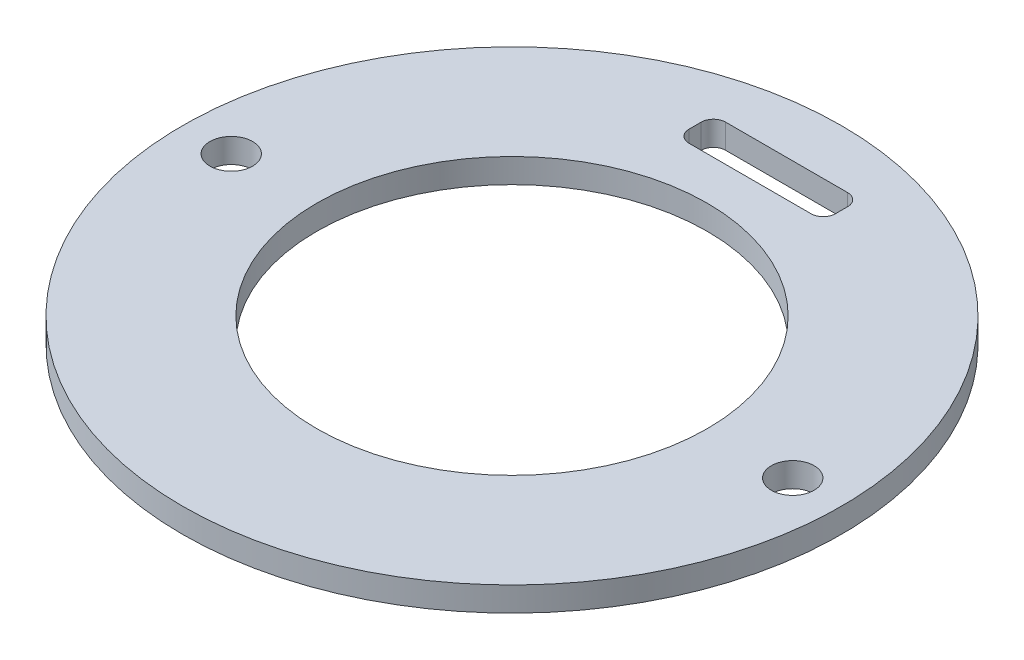
from build123d import *

# Parameters (mm, degrees)
SKETCH1_R           = 27
SKETCH1_R_2         = 16
SKETCH1_R_3         = 1.75
BOSS_EXTRUDE1_DEPTH = 2
SKETCH2_W           = 12
SKETCH2_H           = 3
CUT_EXTRUDE1_DEPTH  = 39.236108589
FILLET1_R           = 1


with BuildPart() as part:
    # Sketch1 → Boss-Extrude1 (new body)
    with BuildSketch(Plane(origin=(0, 0, 0), x_dir=(1, 0, 0), z_dir=(0, 1, 0))):
        Circle(SKETCH1_R)
        Circle(SKETCH1_R_2, mode=Mode.SUBTRACT)
        with Locations((-23, 0)):
            Circle(SKETCH1_R_3, mode=Mode.SUBTRACT)
        with Locations((23, 0)):
            Circle(SKETCH1_R_3, mode=Mode.SUBTRACT)
    extrude(amount=BOSS_EXTRUDE1_DEPTH)

    # Sketch2 → Cut-Extrude1 (cut, through all)
    with BuildSketch(Plane(origin=(0, 2, 0), x_dir=(1, 0, 0), z_dir=(0, 1, 0))):
        with Locations((0, 21)):
            Rectangle(SKETCH2_W, SKETCH2_H)
    extrude(amount=-CUT_EXTRUDE1_DEPTH, mode=Mode.SUBTRACT)

    # Fillet1
    fillet1_edges = [part.edges().sort_by_distance(p)[0] for p in [
        (-6, 1, -19.5),
        (6, 1, -22.5),
        (6, 1, -19.5),
        (-6, 1, -22.5),
    ]]
    fillet(fillet1_edges, radius=FILLET1_R)


solid = part.part
